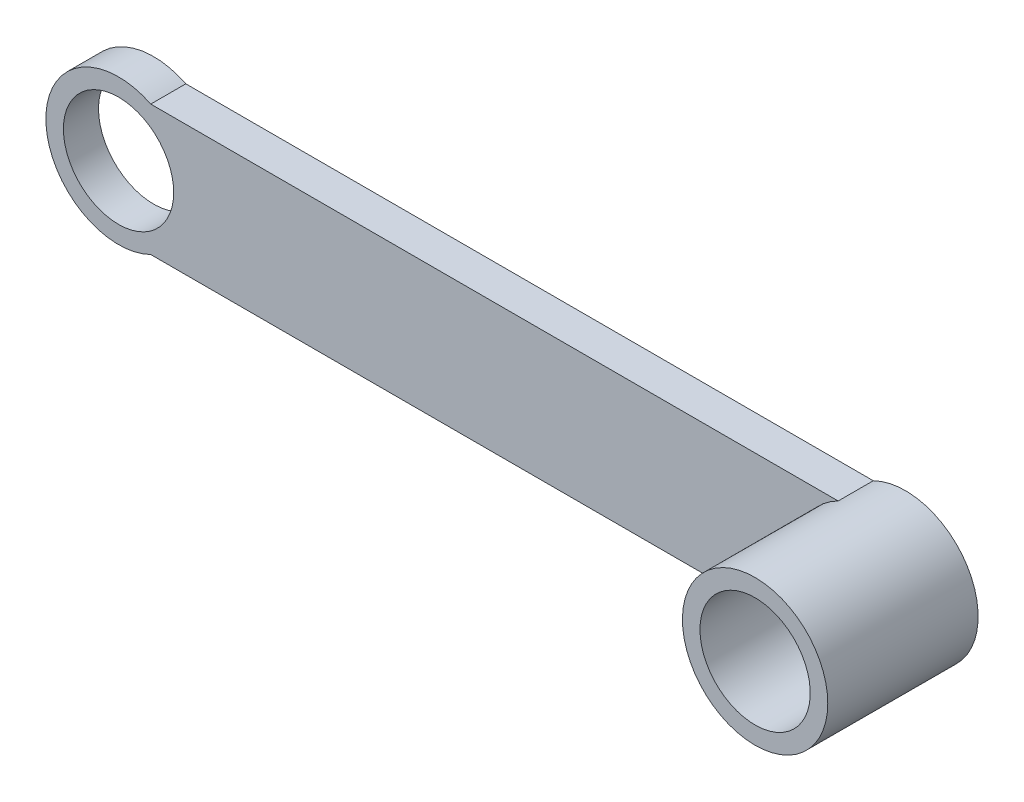
from build123d import *

# Parameters (mm, degrees)
BOSS_EXTRUDE1_DEPTH = 7
SKETCH2_R           = 14.5
BOSS_EXTRUDE2_DEPTH = 23
SKETCH3_R           = 11
CUT_EXTRUDE1_DEPTH  = 96.501309


with BuildPart() as part:
    # Sketch1 → Boss-Extrude1 (new body)
    with BuildSketch(Plane.XY):
        with BuildLine():
            Line((-68.577384, 13), (68.577384, 13))
            ThreePointArc((68.577384, 13), (89.5, 0), (68.577384, -13))
            Line((68.577384, -13), (-68.577384, -13))
            ThreePointArc((-68.577384, -13), (-89.5, 0), (-68.577384, 13))
        make_face()
    extrude(amount=BOSS_EXTRUDE1_DEPTH)

    # Sketch2 → Boss-Extrude2 (add)
    with BuildSketch(Plane.XY.offset(7)):
        with Locations((75, 0)):
            Circle(SKETCH2_R)
    extrude(amount=BOSS_EXTRUDE2_DEPTH)

    # Sketch3 → Cut-Extrude1 (cut, through all)
    with BuildSketch(Plane(origin=(0, 0, 0), x_dir=(-1, 0, 0), z_dir=(0, 0, -1))):
        with Locations((-75, 0)):
            Circle(SKETCH3_R)
        with Locations((75, 0)):
            Circle(SKETCH3_R)
    extrude(amount=-CUT_EXTRUDE1_DEPTH, mode=Mode.SUBTRACT)


solid = part.part
